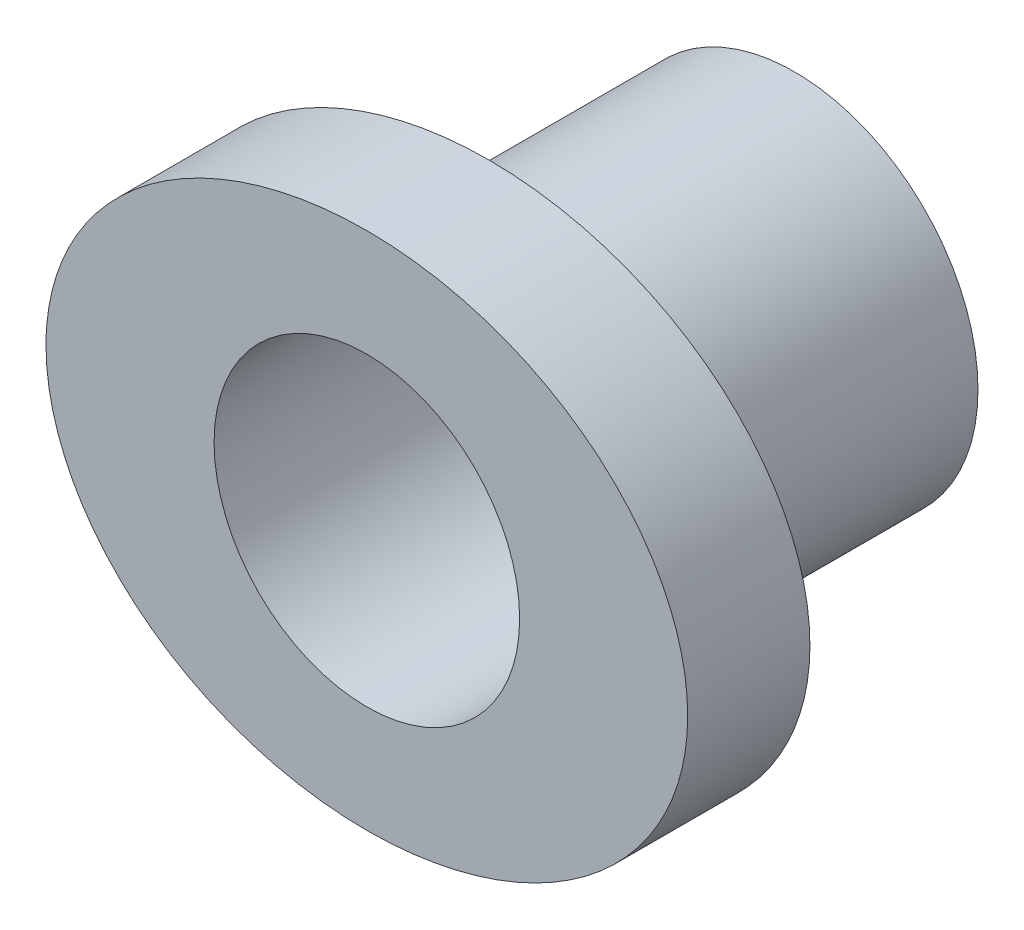
from build123d import *
from build123d.topology import SkipClean

# Parameters (mm, degrees)
SKETCH1_RX          = 5.25
SKETCH1_RY          = 4.25
SKETCH1_R           = 2.5
BOSS_EXTRUDE1_DEPTH = 2
BOSS_EXTRUDE2_START = 5
SKETCH2_R           = 3
SKETCH2_R_2         = 2.5
BOSS_EXTRUDE2_DEPTH = 5


with BuildPart() as part:
    # Sketch1 → Boss-Extrude1 (new body)
    with BuildSketch(Plane.XY):
        with Locations(Location((0, 0), (0, 0, 180))):
            Ellipse(SKETCH1_RX, SKETCH1_RY)
        Circle(SKETCH1_R, mode=Mode.SUBTRACT)
    extrude(amount=BOSS_EXTRUDE1_DEPTH)

    # Sketch2 → Boss-Extrude2 (add)
    with SkipClean():  # the faces are left unmerged after this step: merging them gives an invalid solid
        with BuildSketch(Plane(origin=(0, 0, 0), x_dir=(-1, 0, 0), z_dir=(0, 0, -1)).offset(BOSS_EXTRUDE2_START)):
            Circle(SKETCH2_R)
            Circle(SKETCH2_R_2, mode=Mode.SUBTRACT)
        extrude(amount=-BOSS_EXTRUDE2_DEPTH)


solid = part.part
